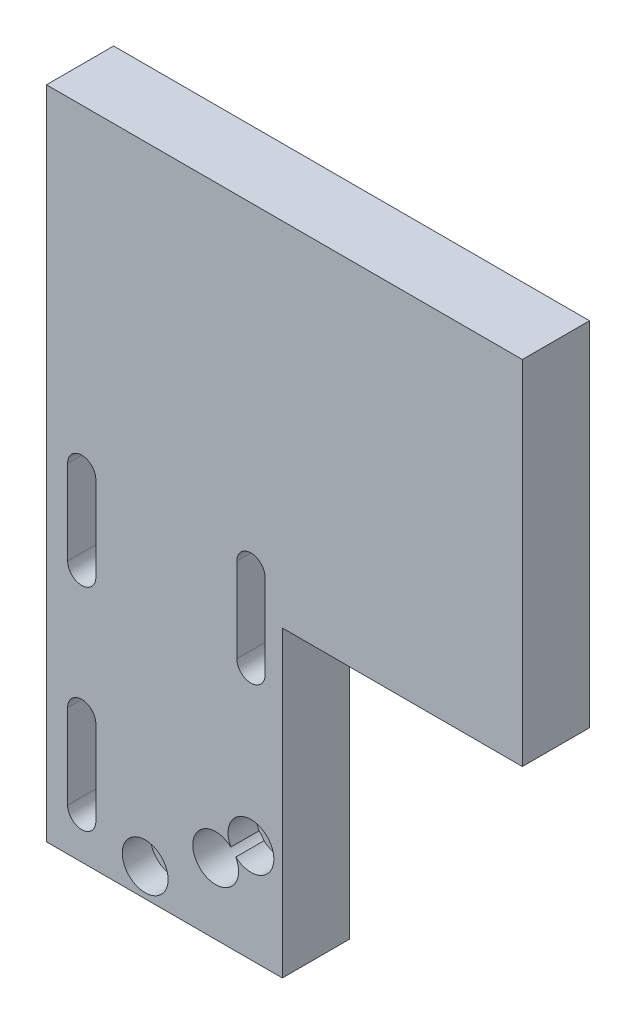
from build123d import *

# Parameters (mm, degrees)
SKETCH1_R           = 3.25
BOSS_EXTRUDE1_DEPTH = 9.525
SKETCH1_4_R         = 2
SKETCH1_4_R_2       = 3.25
BOSS_EXTRUDE3_DEPTH = 5.525
CUT_EXTRUDE1_DEPTH  = 111.281347584
CUT_EXTRUDE2_DEPTH  = 5.525


with BuildPart() as part:
    # Sketch1 → Boss-Extrude1 (new body)
    with BuildSketch(Plane.XY):
        Polygon((-9, 0), (0, 0), (24.45, 0), (24.45, 43), (58.5, 43), (58.5, 93), (0, 93), (-9, 93), align=None)
        with Locations((5, 4)):
            Circle(SKETCH1_R, mode=Mode.SUBTRACT)
        with BuildLine():
            ThreePointArc((17.849215148, 11.563481065), (18.148209748, 10.807016347), (18.25, 10))
            ThreePointArc((18.25, 10), (12.037522087, 8.663502856), (17.150784852, 12.436518935))
            ThreePointArc((17.150784852, 12.436518935), (19.192983653, 17.148209748), (23.25, 14))
            ThreePointArc((23.25, 14), (21.336497144, 11.037522087), (17.849215148, 11.563481065))
        make_face(mode=Mode.SUBTRACT)
    extrude(amount=BOSS_EXTRUDE1_DEPTH)

    # Sketch1<4> → Boss-Extrude3 (add)
    # profile 1 of 2: a face of its own
    with BuildSketch(Plane.XY):
        with BuildLine():
            ThreePointArc((17.150784852, 12.436518935), (17.537823631, 12.030258905), (17.849215148, 11.563481065))
            ThreePointArc((17.849215148, 11.563481065), (22.537823631, 16.030258905), (17.150784852, 12.436518935))
        make_face()
        with Locations((20, 14)):
            Circle(SKETCH1_4_R, mode=Mode.SUBTRACT)
    # profile 2 of 2: a face of its own
    with BuildSketch(Plane.XY):
        with Locations((5, 4)):
            Circle(SKETCH1_4_R_2)
        with Locations((5, 4)):
            Circle(SKETCH1_4_R, mode=Mode.SUBTRACT)
    extrude(amount=BOSS_EXTRUDE3_DEPTH)

    # Sketch3 → Cut-Extrude1 (cut, through all)
    with BuildSketch(Plane.XY.offset(9.525)):
        with BuildLine():
            Line((-2, 18), (-2, 6))
            ThreePointArc((-2, 6), (-4, 4), (-6, 6))
            Line((-6, 6), (-6, 18))
            ThreePointArc((-6, 18), (-4, 20), (-2, 18))
        make_face()
        with BuildLine():
            Line((-6, 48), (-6, 36))
            ThreePointArc((-6, 36), (-4, 34), (-2, 36))
            Line((-2, 36), (-2, 48))
            ThreePointArc((-2, 48), (-4, 50), (-6, 48))
        make_face()
        with BuildLine():
            Line((18, 48), (18, 36))
            ThreePointArc((18, 36), (20, 34), (22, 36))
            Line((22, 36), (22, 48))
            ThreePointArc((22, 48), (20, 50), (18, 48))
        make_face()
    extrude(amount=-CUT_EXTRUDE1_DEPTH, mode=Mode.SUBTRACT)

    # Sketch4 → Cut-Extrude2 (cut)
    with BuildSketch(Plane(origin=(0, 0, 0), x_dir=(-1, 0, 0), z_dir=(0, 0, -1))):
        with BuildLine():
            Line((-16.75, 36), (-16.75, 48))
            ThreePointArc((-16.75, 48), (-20, 51.25), (-23.25, 48))
            Line((-23.25, 48), (-23.25, 36))
            ThreePointArc((-23.25, 36), (-20, 32.75), (-16.75, 36))
        make_face()
        with BuildLine():
            Line((0.75, 48), (0.75, 36))
            ThreePointArc((0.75, 36), (4, 32.75), (7.25, 36))
            Line((7.25, 36), (7.25, 48))
            ThreePointArc((7.25, 48), (4, 51.25), (0.75, 48))
        make_face()
        with BuildLine():
            Line((7.25, 6), (7.25, 18))
            ThreePointArc((7.25, 18), (3.997663937, 21.24999916), (0.75, 17.99532787))
            Line((0.75, 17.99532787), (0.75, 5.99532787))
            ThreePointArc((0.75, 5.99532787), (4.002336066, 2.749997481), (7.25, 6))
        make_face()
    extrude(amount=-CUT_EXTRUDE2_DEPTH, mode=Mode.SUBTRACT)


solid = part.part
